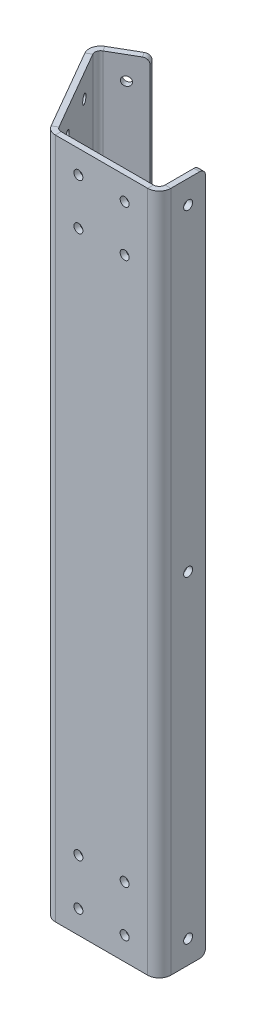
from build123d import *

# Parameters (mm, degrees)
BASE_FLANGE1_DEPTH = 374.65
SKETCH2_R          = 2.45745
CUT_EXTRUDE1_DEPTH = 3.175
SKETCH4_R          = 2.45745
CUT_EXTRUDE2_DEPTH = 3.175
FILLET1_R          = 3.175


# Sheet-metal steps are written as plain solids
with BuildPart() as part:
    # Sketch1 → Base-Flange1 (new body)
    with BuildSketch(Plane(origin=(0, 0, 0), x_dir=(1, 0, 0), z_dir=(0, 1, 0))):
        with BuildLine():
            Line((60.81522, 25.4), (60.81522, 6.35))
            ThreePointArc((60.81522, 6.35), (58.955348061, 1.859871939), (54.46522, 0))
            Line((54.46522, 0), (3.666174209, 0))
            ThreePointArc((3.666174209, 0), (0.491174209, 0.850738686), (-1.833087105, 3.175))
            Line((-1.833087105, 3.175), (-27.23261, 47.168264143))
            ThreePointArc((-27.23261, 47.168264143), (-27.866977683, 51.986765079), (-24.908348686, 55.842525457))
            Line((-24.908348686, 55.842525457), (-8.410564744, 65.367525457))
            Line((-8.410564744, 65.367525457), (-6.823064744, 62.6178948))
            Line((-6.823064744, 62.6178948), (-23.320848686, 53.0928948))
            ThreePointArc((-23.320848686, 53.0928948), (-24.800163184, 51.165014611), (-24.482979343, 48.755764143))
            Line((-24.482979343, 48.755764143), (0.916543552, 4.7625))
            ThreePointArc((0.916543552, 4.7625), (2.078674209, 3.600369343), (3.666174209, 3.175))
            Line((3.666174209, 3.175), (54.46522, 3.175))
            ThreePointArc((54.46522, 3.175), (56.71028403, 4.10493597), (57.64022, 6.35))
            Line((57.64022, 6.35), (57.64022, 25.4))
            Line((57.64022, 25.4), (60.81522, 25.4))
        make_face()
    extrude(amount=BASE_FLANGE1_DEPTH)

    # Sketch2 → Cut-Extrude1 (cut)
    with BuildSketch(Plane.XY):
        with Locations((16.366174209, 361.95)):
            Circle(SKETCH2_R)
        with Locations((16.366174209, 336.55)):
            Circle(SKETCH2_R)
        with Locations((41.766174209, 336.55)):
            Circle(SKETCH2_R)
        with Locations((41.766174209, 361.95)):
            Circle(SKETCH2_R)
        with Locations(Location((41.766174209, 12.7, 0), (0, 0, 180))):
            Circle(SKETCH2_R)
        with Locations(Location((16.366174209, 12.7, 0), (0, 0, 180))):
            Circle(SKETCH2_R)
        with Locations(Location((41.766174209, 38.1, 0), (0, 0, 180))):
            Circle(SKETCH2_R)
        with Locations(Location((16.366174209, 38.1, 0), (0, 0, 180))):
            Circle(SKETCH2_R)
    cut_extrude1 = extrude(amount=-CUT_EXTRUDE1_DEPTH, mode=Mode.SUBTRACT)

    # Sketch4 → Cut-Extrude2 (cut)
    with BuildSketch(Plane(origin=(60.81522, 0, 0), x_dir=(0, 0, -1), z_dir=(1, 0, 0))):
        with Locations((15.875, 361.95)):
            Circle(SKETCH4_R)
        with Locations(Location((15.875, 12.7, 0), (0, 0, 180))):
            Circle(SKETCH4_R)
        with Locations((15.875, 187.325)):
            Circle(SKETCH4_R)
    cut_extrude2 = extrude(amount=-CUT_EXTRUDE2_DEPTH, mode=Mode.SUBTRACT)

    # Mirror1: Cut-Extrude1, Cut-Extrude2 across plane
    add(cut_extrude1.mirror(Plane(origin=(0, 0, 0), x_dir=(-0.49999999999999795, 0, 0.8660254037844398), z_dir=(-0.8660254037844398, 0, -0.49999999999999795))), mode=Mode.SUBTRACT)
    add(cut_extrude2.mirror(Plane(origin=(0, 0, 0), x_dir=(-0.49999999999999795, 0, 0.8660254037844398), z_dir=(-0.8660254037844398, 0, -0.49999999999999795))), mode=Mode.SUBTRACT)

    # Fillet1
    fillet1_edges = [part.edges().sort_by_distance(p)[0] for p in [
        (-7.616814744, 0, -63.992710128),
        (59.22772, 0, -25.4),
        (-7.616814744, 374.65, -63.992710128),
        (59.22772, 374.65, -25.4),
    ]]
    fillet(fillet1_edges, radius=FILLET1_R)


solid = part.part
